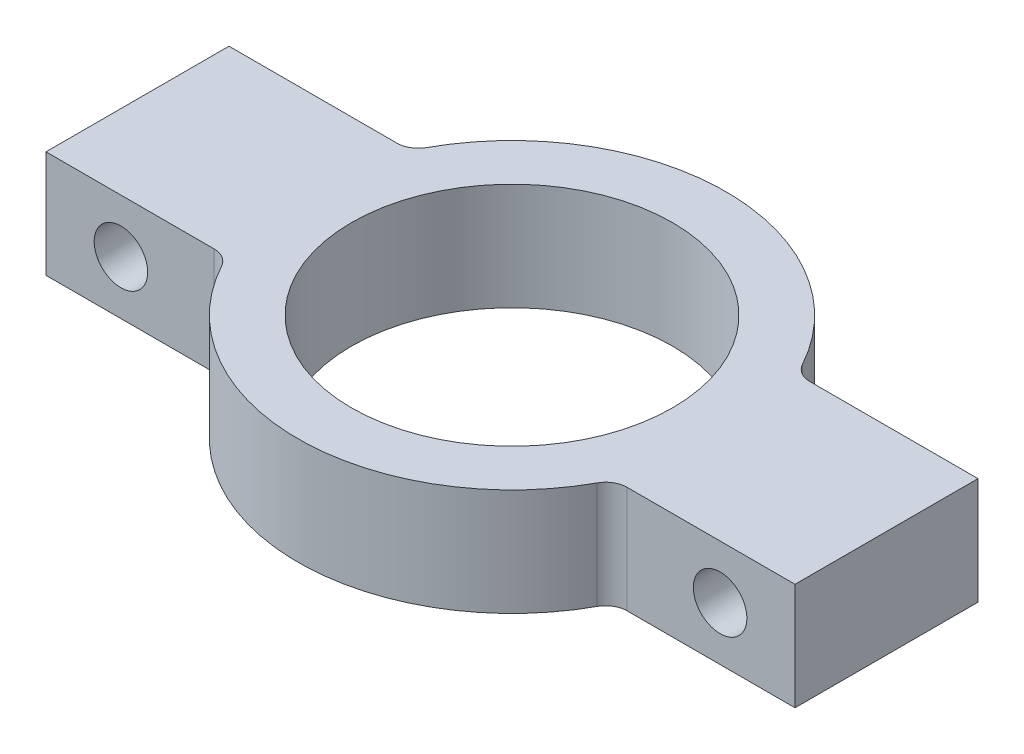
from build123d import *

# Parameters (mm, degrees)
SKETCH_1_R          = 7.5
EXTRUDE_1_DEPTH     = 2.5
SKETCH_2_R          = 1.25
CUT_EXTRUDE_1_DEPTH = 10
FILLET_1_R          = 1


with BuildPart() as part:
    # ｽｹｯﾁ1 → ﾎﾞｽ - 押し出し1 (new, symmetric)
    with BuildSketch(Plane(origin=(0, 0, 0), x_dir=(1, 0, 0), z_dir=(0, 1, 0))):
        with BuildLine():
            Line((-9.040153483, 4.275), (-17.5, 4.275))
            Line((-17.5, 4.275), (-17.5, -4.275))
            Line((-17.5, -4.275), (-9.040153483, -4.275))
            ThreePointArc((-9.040153483, -4.275), (0, -10), (9.040153483, -4.275))
            Line((9.040153483, -4.275), (17.5, -4.275))
            Line((17.5, -4.275), (17.5, 4.275))
            Line((17.5, 4.275), (9.040153483, 4.275))
            ThreePointArc((9.040153483, 4.275), (0, 10), (-9.040153483, 4.275))
        make_face()
        Circle(SKETCH_1_R, mode=Mode.SUBTRACT)
    extrude(amount=EXTRUDE_1_DEPTH, both=True)

    # ｽｹｯﾁ2 → ｶｯﾄ - 押し出し1 (cut)
    with BuildSketch(Plane(origin=(0, 0, -4.275), x_dir=(-1, 0, 0), z_dir=(0, 0, -1))):
        with Locations((14, 0)):
            Circle(SKETCH_2_R)
        with Locations((-14, 0)):
            Circle(SKETCH_2_R)
    extrude(amount=-CUT_EXTRUDE_1_DEPTH, mode=Mode.SUBTRACT)

    # ﾌｨﾚｯﾄ1
    fillet_1_edges = [part.edges().sort_by_distance(p)[0] for p in [
        (-9.040153483, 0, -4.275),
        (9.040153483, 0, -4.275),
        (9.040153483, 0, 4.275),
        (-9.040153483, 0, 4.275),
    ]]
    fillet(fillet_1_edges, radius=FILLET_1_R)


solid = part.part
